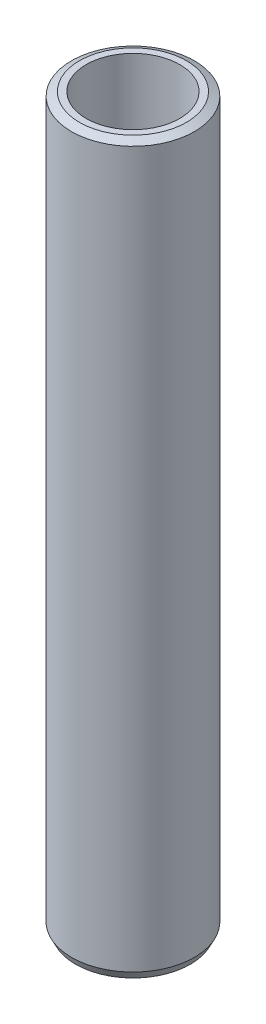
from build123d import *
from OCP.BRepFilletAPI import BRepFilletAPI_MakeChamfer

# Parameters (mm, degrees)
SKETCH1_R           = 50
BOSS_EXTRUDE1_DEPTH = 591.694880101
SKETCH2_R           = 38.054685575
CUT_EXTRUDE1_DEPTH  = 596.905052117
CHAMFER1_SIZE       = 3.267968689
CHAMFER1_SIZE2      = 6.489142508


with BuildPart() as part:
    # Sketch1 → Boss-Extrude1 (new body)
    with BuildSketch(Plane(origin=(0, 0, 0), x_dir=(1, 0, 0), z_dir=(0, 1, 0))):
        Circle(SKETCH1_R)
    extrude(amount=BOSS_EXTRUDE1_DEPTH)

    # Sketch2 → Cut-Extrude1 (cut, through all)
    with BuildSketch(Plane(origin=(0, 0, 0), x_dir=(1, 0, 0), z_dir=(0, 1, 0))):
        Circle(SKETCH2_R)
    extrude(amount=CUT_EXTRUDE1_DEPTH, mode=Mode.SUBTRACT)

    # Chamfer1: one chamfer whose edges measure the first distance from different faces: ONE call of the kernel's chamfer builder (chamfer() names one face for all edges)
    chamfer1_edges_1 = [part.edges().sort_by_distance(p)[0] for p in [
        (-50, 591.694880101, 0),
    ]]
    chamfer1_side_1 = [part.faces().sort_by_distance(p)[0] for p in [
        (-50, 295.847440051, 0),
    ]]
    chamfer1_edges_2 = [part.edges().sort_by_distance(p)[0] for p in [
        (-50, 0, 0),
    ]]
    chamfer1_side_2 = [part.faces().sort_by_distance(p)[0] for p in [
        (-48.585786438, 0, 0),
    ]]
    chamfer1 = BRepFilletAPI_MakeChamfer(part.part.solid().wrapped)
    for e in chamfer1_edges_1:
        chamfer1.Add(CHAMFER1_SIZE, CHAMFER1_SIZE2, e.wrapped, chamfer1_side_1[0].wrapped)  # the first distance lies on this face
    for e in chamfer1_edges_2:
        chamfer1.Add(CHAMFER1_SIZE, CHAMFER1_SIZE2, e.wrapped, chamfer1_side_2[0].wrapped)  # the first distance lies on this face
    add(Compound.cast(chamfer1.Shape()), mode=Mode.REPLACE)


solid = part.part
